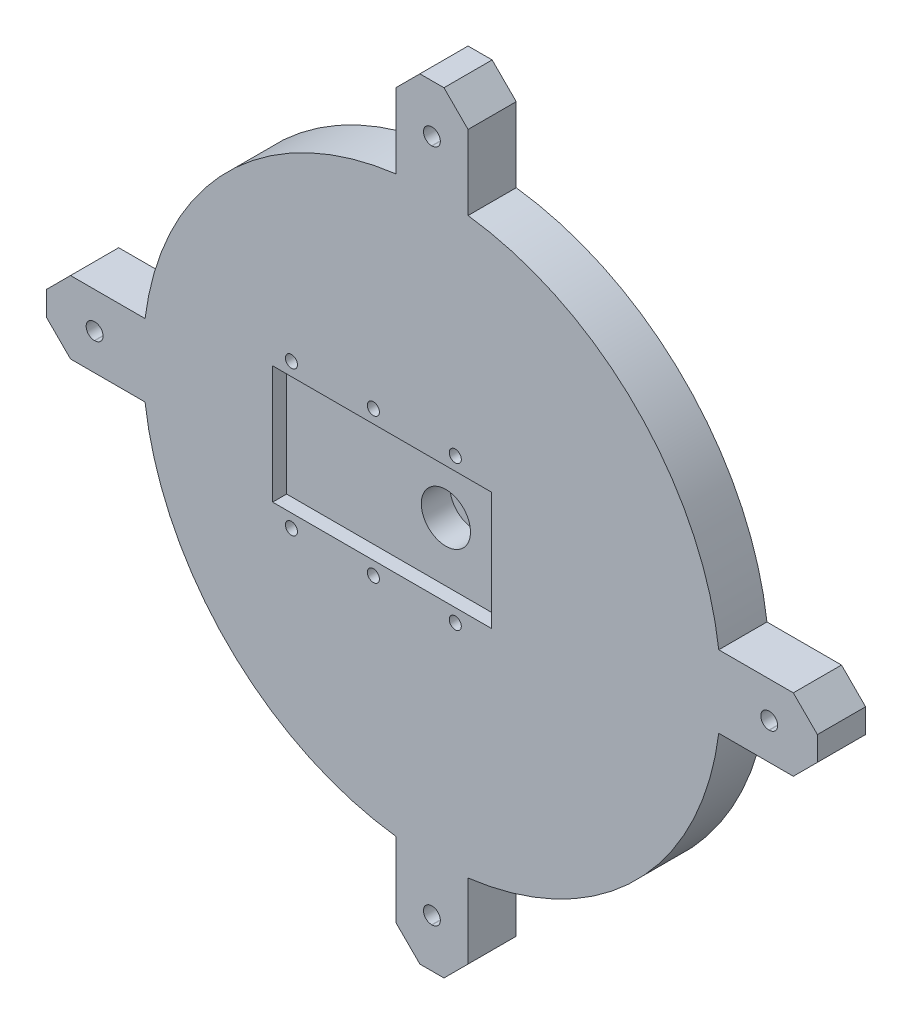
from build123d import *

# Parameters (mm, degrees)
BOSS_EXTRUDE1_DEPTH                            = 10
CBORE_START                                    = -1
CBORE_SLOT_FOR_M3_HEX_HEAD_MACHINE_SCREW_DEPTH = 4.3
CBORE_START_2                                  = 3.3
CBORE_SLOT_FOR_M3_HEX_HEAD_MACHINE_S_3_DEPTH   = 7.7
SKETCH12_R                                     = 1.25
CUT_EXTRUDE4_DEPTH                             = 114.578166925
SKETCH12_5_R                                   = 5.1
CUT_EXTRUDE5_DEPTH                             = 8.85
SKETCH12_6_W                                   = 45.4
SKETCH12_6_H                                   = 24.5
CUT_EXTRUDE6_DEPTH                             = 2.9
SKETCH16_R                                     = 2
CUT_EXTRUDE7_DEPTH                             = 2.5


with BuildPart() as part:
    # Sketch1 → Boss-Extrude1 (new body)
    with BuildSketch(Plane.XY):
        with BuildLine():
            Line((-59.529404499, 7.5), (-75, 7.5))
            Line((-75, 7.5), (-80, 2.5))
            Line((-80, 2.5), (-80, -2.5))
            Line((-80, -2.5), (-75, -7.5))
            Line((-75, -7.5), (-59.529404499, -7.5))
            ThreePointArc((-59.529404499, -7.5), (-42.426406871, -42.426406871), (-7.5, -59.529404499))
            Line((-7.5, -59.529404499), (-7.5, -75))
            Line((-7.5, -75), (-2.5, -80))
            Line((-2.5, -80), (2.5, -80))
            Line((2.5, -80), (7.5, -75))
            Line((7.5, -75), (7.5, -59.529404499))
            ThreePointArc((7.5, -59.529404499), (42.426406871, -42.426406871), (59.529404499, -7.5))
            Line((59.529404499, -7.5), (75, -7.5))
            Line((75, -7.5), (80, -2.5))
            Line((80, -2.5), (80, 2.5))
            Line((80, 2.5), (75, 7.5))
            Line((75, 7.5), (59.529404499, 7.5))
            ThreePointArc((59.529404499, 7.5), (42.426406871, 42.426406871), (7.5, 59.529404499))
            Line((7.5, 59.529404499), (7.5, 75))
            Line((7.5, 75), (2.5, 80))
            Line((2.5, 80), (-2.5, 80))
            Line((-2.5, 80), (-7.5, 75))
            Line((-7.5, 75), (-7.5, 59.529404499))
            ThreePointArc((-7.5, 59.529404499), (-42.426406871, 42.426406871), (-59.529404499, 7.5))
        make_face()
    extrude(amount=BOSS_EXTRUDE1_DEPTH)

    # CBORE SLOT for M3 Hex Head Machine Screw1: read off the stored shape, not the designer's step
    # CBORE SLOT for M3 Hex Head Machine S 2 → CBORE SLOT for M3 Hex Head Machine Screw1 (cut)
    with BuildSketch(Plane.XY.offset(CBORE_START)):
        with BuildLine():
            ThreePointArc((0.05, 65.8), (4.25, 70), (0.05, 74.2))
            Line((0.05, 74.2), (-0.05, 74.2))
            ThreePointArc((-0.05, 74.2), (-4.25, 70), (-0.05, 65.8))
            Line((-0.05, 65.8), (0.05, 65.8))
        make_face()
        with BuildLine():
            ThreePointArc((-69.95, -4.2), (-65.75, 0), (-69.95, 4.2))
            Line((-69.95, 4.2), (-70.05, 4.2))
            ThreePointArc((-70.05, 4.2), (-74.25, 0), (-70.05, -4.2))
            Line((-70.05, -4.2), (-69.95, -4.2))
        make_face()
        with BuildLine():
            ThreePointArc((69.95, 4.2), (65.75, 0), (69.95, -4.2))
            Line((69.95, -4.2), (70.05, -4.2))
            ThreePointArc((70.05, -4.2), (74.25, 0), (70.05, 4.2))
            Line((70.05, 4.2), (69.95, 4.2))
        make_face()
        with BuildLine():
            ThreePointArc((0.05, -74.2), (4.25, -70), (0.05, -65.8))
            Line((0.05, -65.8), (-0.05, -65.8))
            ThreePointArc((-0.05, -65.8), (-4.25, -70), (-0.05, -74.2))
            Line((-0.05, -74.2), (0.05, -74.2))
        make_face()
    extrude(amount=CBORE_SLOT_FOR_M3_HEX_HEAD_MACHINE_SCREW_DEPTH, mode=Mode.SUBTRACT)

    # CBORE SLOT for M3 Hex Head Machine S 3 o → CBORE SLOT for M3 Hex Head Machine S 3 (cut)
    with BuildSketch(Plane.XY.offset(CBORE_START_2)):
        with BuildLine():
            ThreePointArc((0.05, 68.3), (1.75, 70), (0.05, 71.7))
            Line((0.05, 71.7), (-0.05, 71.7))
            ThreePointArc((-0.05, 71.7), (-1.75, 70), (-0.05, 68.3))
            Line((-0.05, 68.3), (0.05, 68.3))
        make_face()
        with BuildLine():
            ThreePointArc((-69.95, -1.7), (-68.25, 0), (-69.95, 1.7))
            Line((-69.95, 1.7), (-70.05, 1.7))
            ThreePointArc((-70.05, 1.7), (-71.75, 0), (-70.05, -1.7))
            Line((-70.05, -1.7), (-69.95, -1.7))
        make_face()
        with BuildLine():
            ThreePointArc((69.95, 1.7), (68.25, 0), (69.95, -1.7))
            Line((69.95, -1.7), (70.05, -1.7))
            ThreePointArc((70.05, -1.7), (71.75, 0), (70.05, 1.7))
            Line((70.05, 1.7), (69.95, 1.7))
        make_face()
        with BuildLine():
            ThreePointArc((0.05, -71.7), (1.75, -70), (0.05, -68.3))
            Line((0.05, -68.3), (-0.05, -68.3))
            ThreePointArc((-0.05, -68.3), (-1.75, -70), (-0.05, -71.7))
            Line((-0.05, -71.7), (0.05, -71.7))
        make_face()
    extrude(amount=CBORE_SLOT_FOR_M3_HEX_HEAD_MACHINE_S_3_DEPTH, mode=Mode.SUBTRACT)

    # CBORE SLOT for M3 Hex Head Machine S 4: loft between two sections, ruled curve by curve
    cbore_slot_for_m3_hex_head_machine_s_4_from = [
        Edge.make_three_point_arc((0.05, 74.2, 0.025), (3.019848481, 72.969848481, 0.025), (4.25, 70, 0.025)),
        Edge.make_three_point_arc((4.25, 70, 0.025), (3.019848481, 67.030151519, 0.025), (0.05, 65.8, 0.025)),
        Edge.make_three_point_arc((-0.05, 65.8, 0.025), (-3.019848481, 67.030151519, 0.025), (-4.25, 70, 0.025)),
        Edge.make_three_point_arc((-4.25, 70, 0.025), (-3.019848481, 72.969848481, 0.025), (-0.05, 74.2, 0.025)),
        Edge.make_line((0.05, 65.8, 0.025), (-0.05, 65.8, 0.025)),
        Edge.make_line((0.05, 74.2, 0.025), (-0.05, 74.2, 0.025)),
    ]
    cbore_slot_for_m3_hex_head_machine_s_4_to = [
        Edge.make_three_point_arc((0.05, 74.225, 0), (3.037526151, 72.987526151, 0), (4.275, 70, 0)),
        Edge.make_three_point_arc((4.275, 70, 0), (3.037526151, 67.012473849, 0), (0.05, 65.775, 0)),
        Edge.make_three_point_arc((-0.05, 65.775, 0), (-3.037526151, 67.012473849, 0), (-4.275, 70, 0)),
        Edge.make_three_point_arc((-4.275, 70, 0), (-3.037526151, 72.987526151, 0), (-0.05, 74.225, 0)),
        Edge.make_line((0.05, 65.775, 0), (-0.05, 65.775, 0)),
        Edge.make_line((0.05, 74.225, 0), (-0.05, 74.225, 0)),
    ]
    cbore_slot_for_m3_hex_head_machine_s_4 = Solid(Shell([*[Face.make_surface_from_curves(cbore_slot_for_m3_hex_head_machine_s_4_from[k], cbore_slot_for_m3_hex_head_machine_s_4_to[k]) for k in range(6)], Face(Wire(cbore_slot_for_m3_hex_head_machine_s_4_from)), Face(Wire(cbore_slot_for_m3_hex_head_machine_s_4_to))]))
    add(cbore_slot_for_m3_hex_head_machine_s_4, mode=Mode.SUBTRACT)

    # CBORE SLOT for M3 Hex Head Machine S 5: loft between two sections, ruled curve by curve
    cbore_slot_for_m3_hex_head_machine_s_5_from = [
        Edge.make_three_point_arc((-69.95, 4.2, 0.025), (-66.980151519, 2.969848481, 0.025), (-65.75, 0, 0.025)),
        Edge.make_three_point_arc((-65.75, 0, 0.025), (-66.980151519, -2.969848481, 0.025), (-69.95, -4.2, 0.025)),
        Edge.make_three_point_arc((-70.05, -4.2, 0.025), (-73.019848481, -2.969848481, 0.025), (-74.25, 0, 0.025)),
        Edge.make_three_point_arc((-74.25, 0, 0.025), (-73.019848481, 2.969848481, 0.025), (-70.05, 4.2, 0.025)),
        Edge.make_line((-69.95, -4.2, 0.025), (-70.05, -4.2, 0.025)),
        Edge.make_line((-69.95, 4.2, 0.025), (-70.05, 4.2, 0.025)),
    ]
    cbore_slot_for_m3_hex_head_machine_s_5_to = [
        Edge.make_three_point_arc((-69.95, 4.225, 0), (-66.962473849, 2.987526151, 0), (-65.725, 0, 0)),
        Edge.make_three_point_arc((-65.725, 0, 0), (-66.962473849, -2.987526151, 0), (-69.95, -4.225, 0)),
        Edge.make_three_point_arc((-70.05, -4.225, 0), (-73.037526151, -2.987526151, 0), (-74.275, 0, 0)),
        Edge.make_three_point_arc((-74.275, 0, 0), (-73.037526151, 2.987526151, 0), (-70.05, 4.225, 0)),
        Edge.make_line((-69.95, -4.225, 0), (-70.05, -4.225, 0)),
        Edge.make_line((-69.95, 4.225, 0), (-70.05, 4.225, 0)),
    ]
    cbore_slot_for_m3_hex_head_machine_s_5 = Solid(Shell([*[Face.make_surface_from_curves(cbore_slot_for_m3_hex_head_machine_s_5_from[k], cbore_slot_for_m3_hex_head_machine_s_5_to[k]) for k in range(6)], Face(Wire(cbore_slot_for_m3_hex_head_machine_s_5_from)), Face(Wire(cbore_slot_for_m3_hex_head_machine_s_5_to))]))
    add(cbore_slot_for_m3_hex_head_machine_s_5, mode=Mode.SUBTRACT)

    # CBORE SLOT for M3 Hex Head Machine S 6: loft between two sections, ruled curve by curve
    cbore_slot_for_m3_hex_head_machine_s_6_from = [
        Edge.make_three_point_arc((70.05, 4.2, 0.025), (73.019848481, 2.969848481, 0.025), (74.25, 0, 0.025)),
        Edge.make_three_point_arc((74.25, 0, 0.025), (73.019848481, -2.969848481, 0.025), (70.05, -4.2, 0.025)),
        Edge.make_three_point_arc((69.95, -4.2, 0.025), (66.980151519, -2.969848481, 0.025), (65.75, 0, 0.025)),
        Edge.make_three_point_arc((65.75, 0, 0.025), (66.980151519, 2.969848481, 0.025), (69.95, 4.2, 0.025)),
        Edge.make_line((70.05, -4.2, 0.025), (69.95, -4.2, 0.025)),
        Edge.make_line((70.05, 4.2, 0.025), (69.95, 4.2, 0.025)),
    ]
    cbore_slot_for_m3_hex_head_machine_s_6_to = [
        Edge.make_three_point_arc((70.05, 4.225, 0), (73.037526151, 2.987526151, 0), (74.275, 0, 0)),
        Edge.make_three_point_arc((74.275, 0, 0), (73.037526151, -2.987526151, 0), (70.05, -4.225, 0)),
        Edge.make_three_point_arc((69.95, -4.225, 0), (66.962473849, -2.987526151, 0), (65.725, 0, 0)),
        Edge.make_three_point_arc((65.725, 0, 0), (66.962473849, 2.987526151, 0), (69.95, 4.225, 0)),
        Edge.make_line((70.05, -4.225, 0), (69.95, -4.225, 0)),
        Edge.make_line((70.05, 4.225, 0), (69.95, 4.225, 0)),
    ]
    cbore_slot_for_m3_hex_head_machine_s_6 = Solid(Shell([*[Face.make_surface_from_curves(cbore_slot_for_m3_hex_head_machine_s_6_from[k], cbore_slot_for_m3_hex_head_machine_s_6_to[k]) for k in range(6)], Face(Wire(cbore_slot_for_m3_hex_head_machine_s_6_from)), Face(Wire(cbore_slot_for_m3_hex_head_machine_s_6_to))]))
    add(cbore_slot_for_m3_hex_head_machine_s_6, mode=Mode.SUBTRACT)

    # CBORE SLOT for M3 Hex Head Machine S 7: loft between two sections, ruled curve by curve
    cbore_slot_for_m3_hex_head_machine_s_7_from = [
        Edge.make_three_point_arc((0.05, -65.8, 0.025), (3.019848481, -67.030151519, 0.025), (4.25, -70, 0.025)),
        Edge.make_three_point_arc((4.25, -70, 0.025), (3.019848481, -72.969848481, 0.025), (0.05, -74.2, 0.025)),
        Edge.make_three_point_arc((-0.05, -74.2, 0.025), (-3.019848481, -72.969848481, 0.025), (-4.25, -70, 0.025)),
        Edge.make_three_point_arc((-4.25, -70, 0.025), (-3.019848481, -67.030151519, 0.025), (-0.05, -65.8, 0.025)),
        Edge.make_line((0.05, -74.2, 0.025), (-0.05, -74.2, 0.025)),
        Edge.make_line((0.05, -65.8, 0.025), (-0.05, -65.8, 0.025)),
    ]
    cbore_slot_for_m3_hex_head_machine_s_7_to = [
        Edge.make_three_point_arc((0.05, -65.775, 0), (3.037526151, -67.012473849, 0), (4.275, -70, 0)),
        Edge.make_three_point_arc((4.275, -70, 0), (3.037526151, -72.987526151, 0), (0.05, -74.225, 0)),
        Edge.make_three_point_arc((-0.05, -74.225, 0), (-3.037526151, -72.987526151, 0), (-4.275, -70, 0)),
        Edge.make_three_point_arc((-4.275, -70, 0), (-3.037526151, -67.012473849, 0), (-0.05, -65.775, 0)),
        Edge.make_line((0.05, -74.225, 0), (-0.05, -74.225, 0)),
        Edge.make_line((0.05, -65.775, 0), (-0.05, -65.775, 0)),
    ]
    cbore_slot_for_m3_hex_head_machine_s_7 = Solid(Shell([*[Face.make_surface_from_curves(cbore_slot_for_m3_hex_head_machine_s_7_from[k], cbore_slot_for_m3_hex_head_machine_s_7_to[k]) for k in range(6)], Face(Wire(cbore_slot_for_m3_hex_head_machine_s_7_from)), Face(Wire(cbore_slot_for_m3_hex_head_machine_s_7_to))]))
    add(cbore_slot_for_m3_hex_head_machine_s_7, mode=Mode.SUBTRACT)

    # Sketch12 → Cut-Extrude4 (cut, through all)
    with BuildSketch(Plane.XY.offset(10)):
        with Locations((4.85, 15)):
            Circle(SKETCH12_R)
        with Locations((-12.15, 15)):
            Circle(SKETCH12_R)
        with Locations((-29.15, 15)):
            Circle(SKETCH12_R)
        with Locations(Location((-29.15, -15, 0), (0, 0, 180))):
            Circle(SKETCH12_R)
        with Locations(Location((-12.15, -15, 0), (0, 0, 180))):
            Circle(SKETCH12_R)
        with Locations(Location((4.85, -15, 0), (0, 0, 180))):
            Circle(SKETCH12_R)
    extrude(amount=-CUT_EXTRUDE4_DEPTH, mode=Mode.SUBTRACT)

    # Sketch12<5> → Cut-Extrude5 (cut)
    with BuildSketch(Plane.XY.offset(10)):
        Circle(SKETCH12_5_R)
    extrude(amount=-CUT_EXTRUDE5_DEPTH, mode=Mode.SUBTRACT)

    # Sketch12<6> → Cut-Extrude6 (cut)
    with BuildSketch(Plane.XY.offset(10)):
        with Locations((-10.35, 0)):
            Rectangle(SKETCH12_6_W, SKETCH12_6_H)
    extrude(amount=-CUT_EXTRUDE6_DEPTH, mode=Mode.SUBTRACT)

    # Sketch16 → Cut-Extrude7 (cut)
    with BuildSketch(Plane(origin=(0, 0, 0), x_dir=(-1, 0, 0), z_dir=(0, 0, -1))):
        with Locations((-4.85, 15)):
            Circle(SKETCH16_R)
        with Locations((12.15, 15)):
            Circle(SKETCH16_R)
        with Locations((29.15, 15)):
            Circle(SKETCH16_R)
        with Locations((-4.85, -15)):
            Circle(SKETCH16_R)
        with Locations((12.15, -15)):
            Circle(SKETCH16_R)
        with Locations((29.15, -15)):
            Circle(SKETCH16_R)
    extrude(amount=-CUT_EXTRUDE7_DEPTH, mode=Mode.SUBTRACT)


solid = part.part
